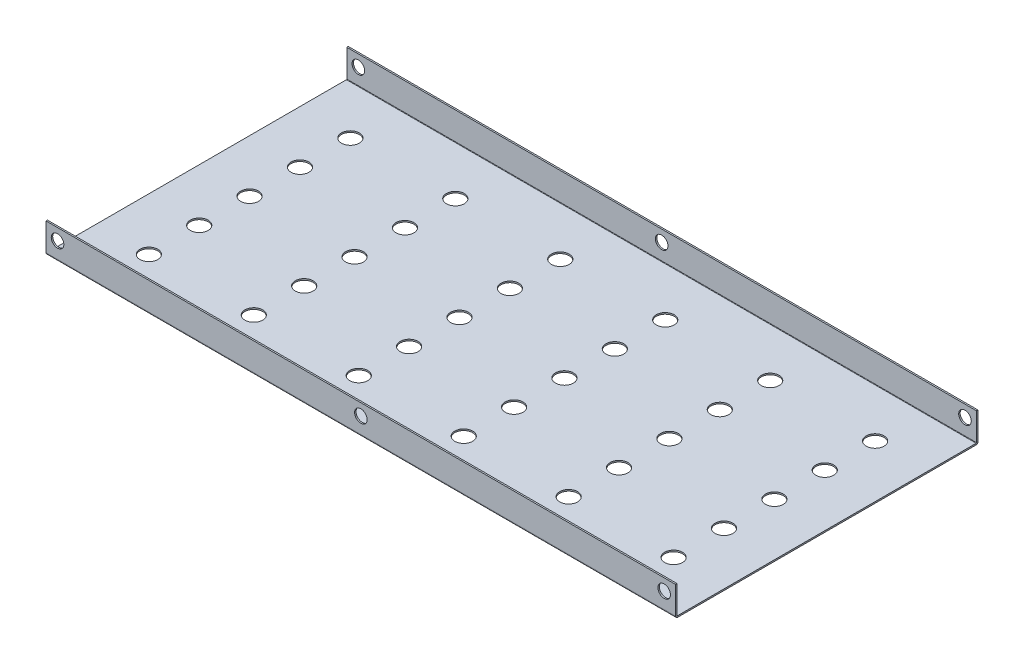
from build123d import *

# Parameters (mm, degrees)
SKETCH_1_W                         = 300
SKETCH_1_H                         = 144
SKETCH_1_R                         = 4.25
SM_BASE_FLANGE_1_DEPTH             = 0.7
SM_EDGE_FLANGE_1_STRIP_W           = 3.2
SM_EDGE_FLANGE_1_STRIP_H           = 0.7
SM_EDGE_FLANGE_1_STRIP_CUT_DEPTH   = 300
SM_EDGE_FLANGE_1_STRIP_2_W         = 3.2
SM_EDGE_FLANGE_1_STRIP_2_H         = 0.7
SM_EDGE_FLANGE_1_STRIP_CUT_2_DEPTH = 300
SM_EDGE_FLANGE_1_DEPTH             = 300
SM_EDGE_FLANGE_1_BEND_DEPTH        = 300
SKETCH_14_R                        = 3
CUT_EXTRUDE_1_DEPTH                = 10
SKETCH_15_R                        = 3
CUT_EXTRUDE_2_DEPTH                = 10


# Sheet-metal steps are written as plain solids
with BuildPart() as part:
    # Sketch 1 → 基体-法兰1 (new body)
    with BuildSketch(Plane(origin=(0, 0, 0), x_dir=(1, 0, 0), z_dir=(0, 1, 0))):
        Rectangle(SKETCH_1_W, SKETCH_1_H)
        with Locations(Location((-125, -48, 0), (0, 0, 270))):
            Circle(SKETCH_1_R, mode=Mode.SUBTRACT)
        with Locations(Location((-125, -24, 0), (0, 0, 270))):
            Circle(SKETCH_1_R, mode=Mode.SUBTRACT)
        with Locations(Location((-125, 0, 0), (0, 0, 270))):
            Circle(SKETCH_1_R, mode=Mode.SUBTRACT)
        with Locations(Location((-125, 24, 0), (0, 0, 270))):
            Circle(SKETCH_1_R, mode=Mode.SUBTRACT)
        with Locations(Location((-125, 48, 0), (0, 0, 270))):
            Circle(SKETCH_1_R, mode=Mode.SUBTRACT)
        with Locations(Location((-75, -48, 0), (0, 0, 90))):
            Circle(SKETCH_1_R, mode=Mode.SUBTRACT)
        with Locations(Location((-75, -24, 0), (0, 0, 90))):
            Circle(SKETCH_1_R, mode=Mode.SUBTRACT)
        with Locations(Location((-75, 0, 0), (0, 0, 90))):
            Circle(SKETCH_1_R, mode=Mode.SUBTRACT)
        with Locations(Location((-75, 24, 0), (0, 0, 90))):
            Circle(SKETCH_1_R, mode=Mode.SUBTRACT)
        with Locations(Location((-75, 48, 0), (0, 0, 90))):
            Circle(SKETCH_1_R, mode=Mode.SUBTRACT)
        with Locations(Location((-25, -48, 0), (0, 0, 270))):
            Circle(SKETCH_1_R, mode=Mode.SUBTRACT)
        with Locations(Location((-25, -24, 0), (0, 0, 270))):
            Circle(SKETCH_1_R, mode=Mode.SUBTRACT)
        with Locations(Location((-25, 0, 0), (0, 0, 270))):
            Circle(SKETCH_1_R, mode=Mode.SUBTRACT)
        with Locations(Location((-25, 24, 0), (0, 0, 270))):
            Circle(SKETCH_1_R, mode=Mode.SUBTRACT)
        with Locations(Location((-25, 48, 0), (0, 0, 270))):
            Circle(SKETCH_1_R, mode=Mode.SUBTRACT)
        with Locations(Location((25, -48, 0), (0, 0, 90))):
            Circle(SKETCH_1_R, mode=Mode.SUBTRACT)
        with Locations(Location((25, -24, 0), (0, 0, 90))):
            Circle(SKETCH_1_R, mode=Mode.SUBTRACT)
        with Locations(Location((25, 0, 0), (0, 0, 90))):
            Circle(SKETCH_1_R, mode=Mode.SUBTRACT)
        with Locations(Location((25, 24, 0), (0, 0, 90))):
            Circle(SKETCH_1_R, mode=Mode.SUBTRACT)
        with Locations(Location((25, 48, 0), (0, 0, 90))):
            Circle(SKETCH_1_R, mode=Mode.SUBTRACT)
        with Locations(Location((75, 48, 0), (0, 0, 270))):
            Circle(SKETCH_1_R, mode=Mode.SUBTRACT)
        with Locations(Location((75, 24, 0), (0, 0, 270))):
            Circle(SKETCH_1_R, mode=Mode.SUBTRACT)
        with Locations(Location((75, 0, 0), (0, 0, 270))):
            Circle(SKETCH_1_R, mode=Mode.SUBTRACT)
        with Locations(Location((75, -24, 0), (0, 0, 270))):
            Circle(SKETCH_1_R, mode=Mode.SUBTRACT)
        with Locations(Location((75, -48, 0), (0, 0, 270))):
            Circle(SKETCH_1_R, mode=Mode.SUBTRACT)
        with Locations(Location((125, -48, 0), (0, 0, 90))):
            Circle(SKETCH_1_R, mode=Mode.SUBTRACT)
        with Locations(Location((125, -24, 0), (0, 0, 90))):
            Circle(SKETCH_1_R, mode=Mode.SUBTRACT)
        with Locations(Location((125, 0, 0), (0, 0, 90))):
            Circle(SKETCH_1_R, mode=Mode.SUBTRACT)
        with Locations(Location((125, 24, 0), (0, 0, 90))):
            Circle(SKETCH_1_R, mode=Mode.SUBTRACT)
        with Locations(Location((125, 48, 0), (0, 0, 90))):
            Circle(SKETCH_1_R, mode=Mode.SUBTRACT)
    extrude(amount=-SM_BASE_FLANGE_1_DEPTH)

    # 边线-法兰1 strip (across the edge) → 边线-法兰1 strip cut (cut)
    with BuildSketch(Plane(origin=(-150, 0, 72), x_dir=(0, 0, -1), z_dir=(1, 0, 0))):
        with Locations((-0.7, -0.35)):
            Rectangle(SM_EDGE_FLANGE_1_STRIP_W, SM_EDGE_FLANGE_1_STRIP_H)
    extrude(amount=SM_EDGE_FLANGE_1_STRIP_CUT_DEPTH, mode=Mode.SUBTRACT)

    # 边线-法兰1 strip 2 (across the edge) → 边线-法兰1 strip cut 2 (cut)
    with BuildSketch(Plane(origin=(150, 0, -72), x_dir=(0, 0, 1), z_dir=(-1, 0, 0))):
        with Locations((-0.7, -0.35)):
            Rectangle(SM_EDGE_FLANGE_1_STRIP_2_W, SM_EDGE_FLANGE_1_STRIP_2_H)
    extrude(amount=SM_EDGE_FLANGE_1_STRIP_CUT_2_DEPTH, mode=Mode.SUBTRACT)

    # 边线-法兰1 section (across the edge) → 边线-法兰1 (add)
    with BuildSketch(Plane(origin=(-150, 0, 72), x_dir=(0, 0, -1), z_dir=(1, 0, 0))):
        with BuildLine():
            Line((0, 0.2), (0, 13.3))
            Line((0, 13.3), (0.7, 13.3))
            Line((0.7, 13.3), (0.7, 0.2))
            ThreePointArc((0.7, 0.2), (0.758578644, 0.058578644), (0.9, 0))
            Line((0.9, 0), (0.9, -0.7))
            ThreePointArc((0.9, -0.7), (0.263603897, -0.436396103), (0, 0.2))
        make_face()
    extrude(amount=SM_EDGE_FLANGE_1_DEPTH)

    # 边线-法兰1 section 2 (across the edge) → 边线-法兰1 bend (add)
    with BuildSketch(Plane(origin=(150, 0, -72), x_dir=(0, 0, 1), z_dir=(-1, 0, 0))):
        with BuildLine():
            Line((0, 0.2), (0, 13.3))
            Line((0, 13.3), (0.7, 13.3))
            Line((0.7, 13.3), (0.7, 0.2))
            ThreePointArc((0.7, 0.2), (0.758578644, 0.058578644), (0.9, 0))
            Line((0.9, 0), (0.9, -0.7))
            ThreePointArc((0.9, -0.7), (0.263603897, -0.436396103), (0, 0.2))
        make_face()
    extrude(amount=SM_EDGE_FLANGE_1_BEND_DEPTH)

    # 草图14 → 切除-拉伸1 (cut)
    with BuildSketch(Plane(origin=(0, 0, 71.3), x_dir=(-1, 0, 0), z_dir=(0, 0, -1))):
        with Locations((-144.5, 7.8)):
            Circle(SKETCH_14_R)
        with Locations((0, 7.8)):
            Circle(SKETCH_14_R)
        with Locations((144.5, 7.8)):
            Circle(SKETCH_14_R)
    extrude(amount=-CUT_EXTRUDE_1_DEPTH, mode=Mode.SUBTRACT)

    # 草图15 → 切除-拉伸2 (cut)
    with BuildSketch(Plane(origin=(0, 0, -72), x_dir=(-1, 0, 0), z_dir=(0, 0, -1))):
        with Locations((-144.5, 7.8)):
            Circle(SKETCH_15_R)
        with Locations((0, 7.8)):
            Circle(SKETCH_15_R)
        with Locations((144.5, 7.8)):
            Circle(SKETCH_15_R)
    extrude(amount=-CUT_EXTRUDE_2_DEPTH, mode=Mode.SUBTRACT)


solid = part.part
